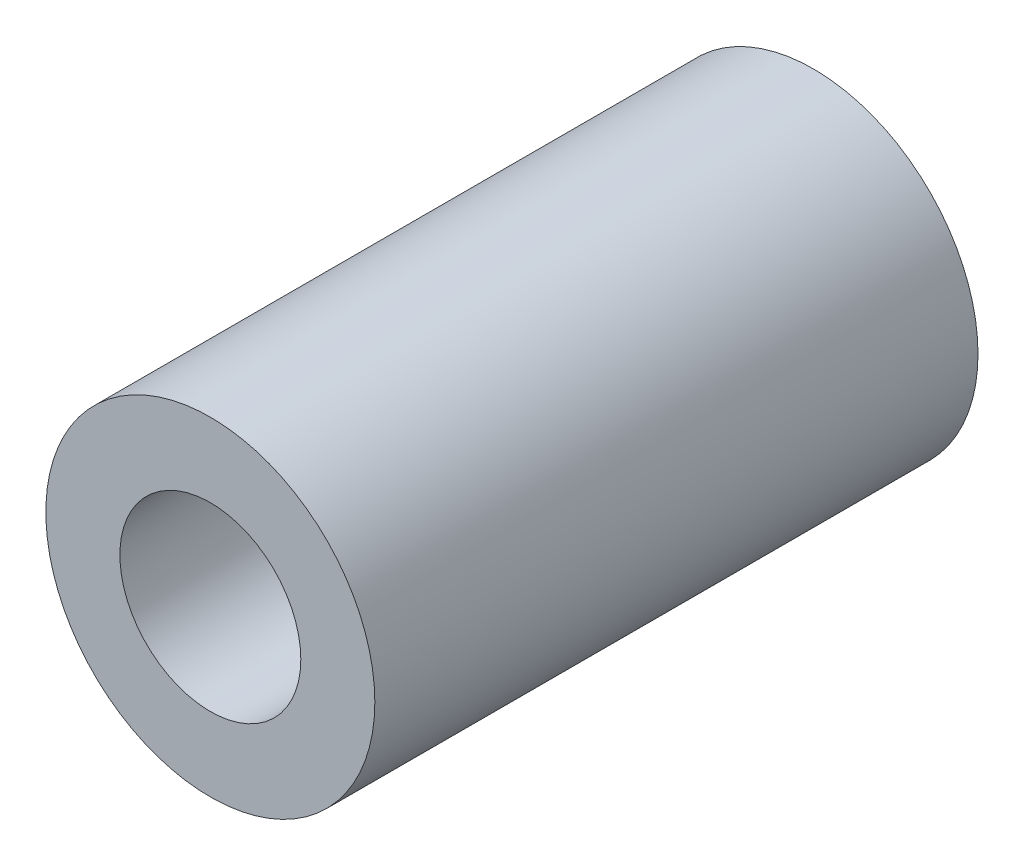
from build123d import *

# Parameters (mm, degrees)
SKETCH_3_R          = 3
SKETCH_3_R_2        = 1.65
EXTRUDE_28886_DEPTH = 11


with BuildPart() as part:
    # Sketch 3 → Extrude 28886 (new body)
    with BuildSketch(Plane.XY):
        Circle(SKETCH_3_R)
        Circle(SKETCH_3_R_2, mode=Mode.SUBTRACT)
    extrude(amount=EXTRUDE_28886_DEPTH)


solid = part.part
